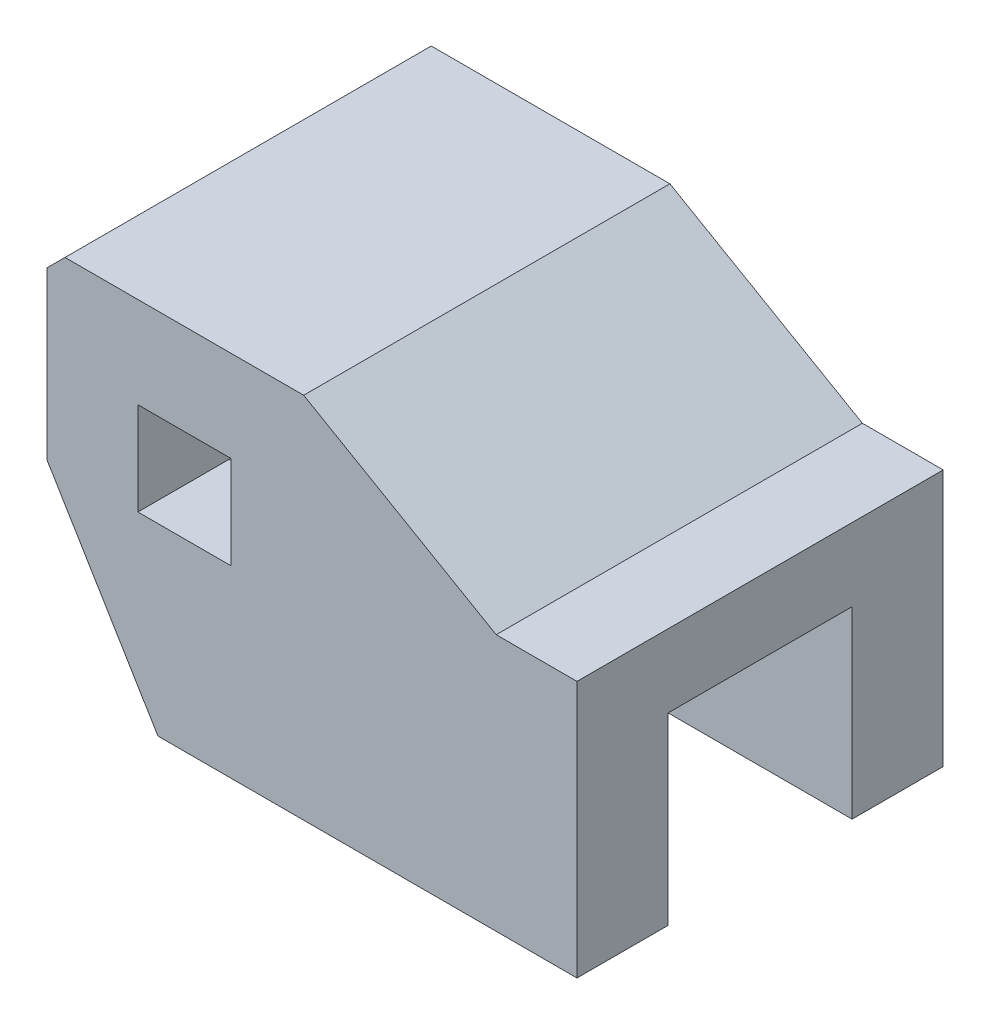
from build123d import *

# Parameters (mm, degrees)
DODANIE_WYCI_GNI_CIE2_DEPTH      = 40
DODANIE_WYCI_GNI_CIE3_DEPTH      = 20.1
DODANIE_WYCI_GNI_CIE3_DEPTH_BACK = 20.1
WYTNIJ_WYCI_GNI_CIE1_DEPTH       = 55.056451974
WYTNIJ_WYCI_GNI_CIE1_DEPTH_BACK  = 30
SFAZOWANIE1_SIZE                 = 2
SZKIC4_W                         = 10
SZKIC4_H                         = 20.2
DODANIE_WYCI_GNI_CIE4_DEPTH      = 6
DODANIE_WYCI_GNI_CIE5_DEPTH      = 40.2
SZKIC6_W                         = 20.2
SZKIC6_H                         = 20.2
WYTNIJ_WYCI_GNI_CIE2_DEPTH       = 40.2
SZKIC7_R                         = 2
WYTNIJ_WYCI_GNI_CIE3_DEPTH       = 10


with BuildPart() as part:
    # Szkic2 → Dodanie-wyciągnięcie2 (new body)
    with BuildSketch(Plane(origin=(0, 0, 0), x_dir=(0, 0, -1), z_dir=(1, 0, 0))):
        Polygon((-20.1, -10.1), (-10.1, -10.1), (-10.1, 10.1), (10.1, 10.1), (10.1, -10.1), (20.1, -10.1), (20.1, 18.1), (-20.1, 18.1), align=None)
    extrude(amount=DODANIE_WYCI_GNI_CIE2_DEPTH)

    # Szkic3 → Dodanie-wyciągnięcie3 (add, two sides: drawn at the far end of the back side and taken through both)
    with BuildSketch(Plane.XY.offset(-DODANIE_WYCI_GNI_CIE3_DEPTH_BACK)):
        Polygon((2, 20.3), (2, 18.1), (31.131019852, 18.1), (10, 30.3), (-18.2, 30.3), (-18.2, 10.1), (-8.2, 10.1), (-8.2, 20.3), align=None)
    extrude(amount=DODANIE_WYCI_GNI_CIE3_DEPTH + DODANIE_WYCI_GNI_CIE3_DEPTH_BACK)

    # Szkic3<3> → Wytnij-wyciągnięcie1 (cut, two sides: drawn at the far end of the back side and taken through both)
    with BuildSketch(Plane.XY.offset(-WYTNIJ_WYCI_GNI_CIE1_DEPTH_BACK)):
        Polygon((0, 10.1), (2, 10.1), (2, 18.1), (2, 20.3), (-8.2, 20.3), (-8.2, 10.1), align=None)
    extrude(amount=WYTNIJ_WYCI_GNI_CIE1_DEPTH + WYTNIJ_WYCI_GNI_CIE1_DEPTH_BACK, mode=Mode.SUBTRACT)

    # Sfazowanie1
    sfazowanie1_edges = [part.edges().sort_by_distance(p)[0] for p in [
        (-18.2, 30.3, 0),
    ]]
    chamfer(sfazowanie1_edges, length=SFAZOWANIE1_SIZE)

    # Szkic4 → Dodanie-wyciągnięcie4 (add)
    with BuildSketch(Plane.ZY):
        with Locations((15.1, 0)):
            Rectangle(SZKIC4_W, SZKIC4_H)
        with Locations((-15.1, 0)):
            Rectangle(SZKIC4_W, SZKIC4_H)
    extrude(amount=DODANIE_WYCI_GNI_CIE4_DEPTH)

    # Szkic5 → Dodanie-wyciągnięcie5 (add)
    with BuildSketch(Plane.XY.offset(20.1)):
        Polygon((-6, -10.1), (-6, 10.1), (-8.2, 10.1), (-18.2, 10.1), align=None)
    extrude(amount=-DODANIE_WYCI_GNI_CIE5_DEPTH)

    # Szkic6 → Wytnij-wyciągnięcie2 (cut)
    with BuildSketch(Plane(origin=(-6, 0, 0), x_dir=(0, 0, -1), z_dir=(1, 0, 0))):
        Rectangle(SZKIC6_W, SZKIC6_H)
    extrude(amount=-WYTNIJ_WYCI_GNI_CIE2_DEPTH, mode=Mode.SUBTRACT)

    # Szkic7 → Wytnij-wyciągnięcie3 (cut)
    with BuildSketch(Plane.XZ.offset(10.1)):
        with Locations((2, 15.1)):
            Circle(SZKIC7_R)
        with Locations((32, 15.1)):
            Circle(SZKIC7_R)
        with Locations((2, -15.1)):
            Circle(SZKIC7_R)
        with Locations((32, -15.1)):
            Circle(SZKIC7_R)
    extrude(amount=-WYTNIJ_WYCI_GNI_CIE3_DEPTH, mode=Mode.SUBTRACT)


solid = part.part
